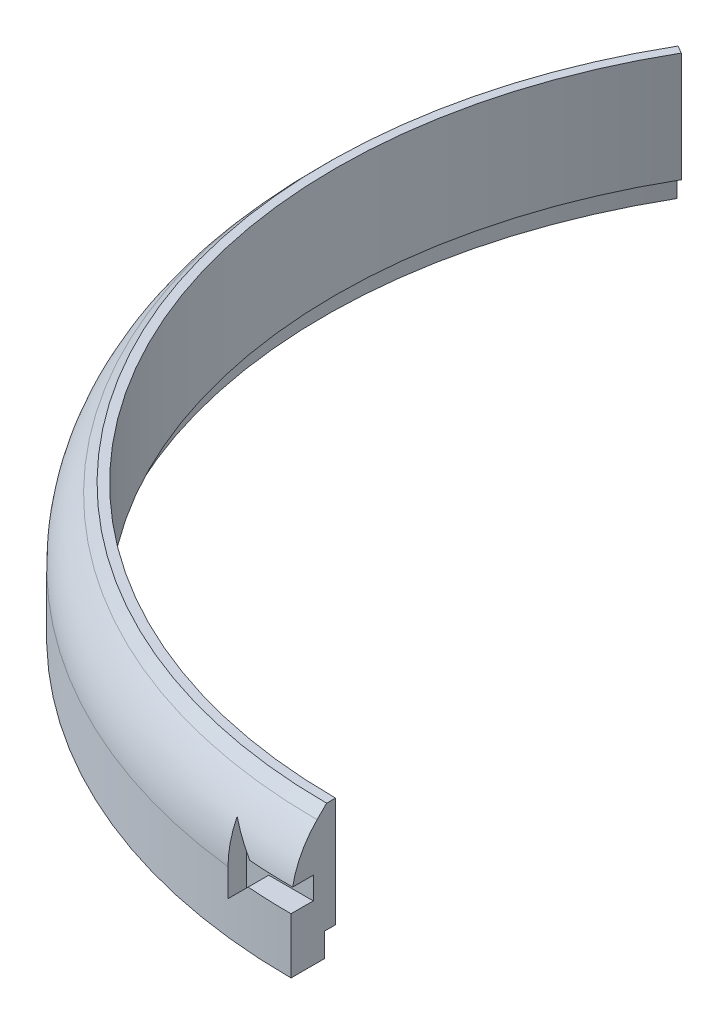
from build123d import *

# Parameters (mm, degrees)
BOSS_EXTRUDE1_DEPTH = 30
SKETCH2_R           = 125
CUT_EXTRUDE1_DEPTH  = 5.35
SKETCH3_W           = 10
SKETCH3_H           = 5
CUT_EXTRUDE2_DEPTH  = 5
CHAMFER2_SIZE       = 8
FILLET1_R           = 20


with BuildPart() as part:
    # Sketch1 → Boss-Extrude1 (new body)
    with BuildSketch(Plane(origin=(0, 0, 0), x_dir=(1, 0, 0), z_dir=(0, 1, 0))):
        with BuildLine():
            Line((-114.748366001, 66.25), (-106.088111964, 61.25))
            ThreePointArc((-106.088111964, 61.25), (-106.088111964, -61.25), (0, -122.5))
            Line((0, -122.5), (0, -132.5))
            ThreePointArc((0, -132.5), (-114.748366001, -66.25), (-114.748366001, 66.25))
        make_face()
    extrude(amount=BOSS_EXTRUDE1_DEPTH)

    # Sketch2 → Cut-Extrude1 (cut)
    with BuildSketch(Plane(origin=(0, 0, 0), x_dir=(1, 0, 0), z_dir=(0, 1, 0))):
        Circle(SKETCH2_R)
    extrude(amount=CUT_EXTRUDE1_DEPTH, mode=Mode.SUBTRACT)

    # Sketch3 → Cut-Extrude2 (cut)
    with BuildSketch(Plane.XY.offset(132.5)):
        with Locations((-5, 15)):
            Rectangle(SKETCH3_W, SKETCH3_H)
        Polygon((-15, 22.5), (-15, 7.5), (-10, 12.5), (-10, 17.5), align=None)
    cut_extrude2 = extrude(amount=-CUT_EXTRUDE2_DEPTH, mode=Mode.SUBTRACT)

    # Mirror1: Cut-Extrude2 across plane
    add(cut_extrude2.mirror(Plane(origin=(0, 0, 0), x_dir=(-0.8660254037844389, 0, 0.4999999999999995), z_dir=(0.4999999999999996, 0, 0.8660254037844389))), mode=Mode.SUBTRACT)

    # Chamfer2
    # the kernel refuses this chamfer: 8 mm, written as the material it takes off along each edge
    with BuildSketch(Plane(origin=(0, 30, 0), x_dir=(0.1547578410621492, 0, 0.9879524333842102), z_dir=(0.9879524333842102, 0, -0.1547578410621492))) as chamfer2_piece_1:
        Polygon((132.5 - CHAMFER2_SIZE, 0), (132.5, CHAMFER2_SIZE), (132.5, 0), align=None)
    revolve(axis=Axis((0, 30, 0), (0, -1, 0)), revolution_arc=137.805504207, mode=Mode.SUBTRACT)

    # Fillet1
    # the kernel refuses this fillet: 20 mm, written as the material it takes off along each edge
    with BuildSketch(Plane(origin=(0, 22, 0), x_dir=(0.04293180283805991, 0, 0.9990780051152532), z_dir=(0.9990780051152532, 0, -0.04293180283805991))) as fillet1_piece_1:
        with BuildLine():
            CenterArc((132.5 - FILLET1_R, FILLET1_R * 0.414213562373), FILLET1_R, 315, 45)
            Line((132.5, FILLET1_R * 0.414213562373), (132.5, 0))
            Line((132.5, 0), (132.5 - FILLET1_R * 0.292893218813, -FILLET1_R * 0.292893218813))
        make_face()
    revolve(axis=Axis((0, 22, 0), (0, -1, 0)), revolution_arc=124.921134732, mode=Mode.SUBTRACT)


solid = part.part
